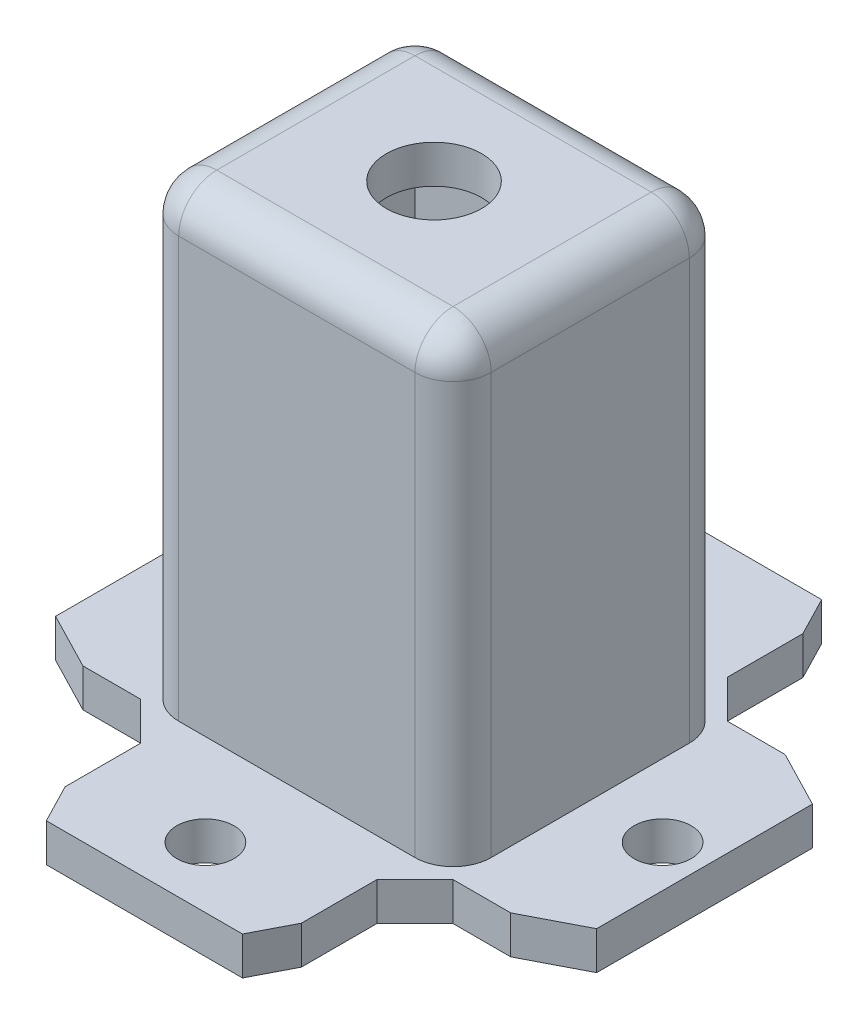
from build123d import *

# Parameters (mm, degrees)
BOSS_EXTRUDE1_START = 0.2
BOSS_EXTRUDE1_DEPTH = 12.4
SKETCH4_R           = 2.5
CUT_EXTRUDE1_DEPTH  = 12
SKETCH5_R           = 1.5
CUT_EXTRUDE2_DEPTH  = 12
BOSS_EXTRUDE3_DEPTH = 14.4
CIRPATTERN1_COUNT   = 2
CIRPATTERN1_ANGLE   = 90
CUT_EXTRUDE3_DEPTH  = 10
CHAMFER1_SIZE       = 2
FILLET1_R           = 2


with BuildPart() as part:
    # Sketch3 → Boss-Extrude1 (new body)
    with BuildSketch(Plane.ZY.offset(6.000000089).offset(BOSS_EXTRUDE1_START)):
        Polygon((5.2, 81), (5.2, 105.05), (-5.2, 105.05), (-5.2, 81), (-15.2, 81), (-15.2, 83), (-7.2, 83), (-7.2, 107.05), (7.2, 107.05), (7.2, 85.378651171), (7.2, 83), (15.2, 83), (15.2, 81), align=None)
    extrude(amount=-BOSS_EXTRUDE1_DEPTH)

    # Sketch4 → Cut-Extrude1 (cut)
    with BuildSketch(Plane(origin=(0, 107.05, 0), x_dir=(1, 0, 0), z_dir=(0, 1, 0))):
        with Locations(Location((0, 0, 0), (0, 0, 180))):
            Circle(SKETCH4_R)
    extrude(amount=-CUT_EXTRUDE1_DEPTH, mode=Mode.SUBTRACT)

    # Sketch5 → Cut-Extrude2 (cut)
    with BuildSketch(Plane(origin=(0, 83, 0), x_dir=(1, 0, 0), z_dir=(0, 1, 0))):
        with Locations(Location((-1.03e-07, 12, 0), (0, 0, 180))):
            Circle(SKETCH5_R)
        with Locations(Location((-1.03e-07, -12, 0), (0, 0, 180))):
            Circle(SKETCH5_R)
    cut_extrude2 = extrude(amount=-CUT_EXTRUDE2_DEPTH, mode=Mode.SUBTRACT)

    # Sketch7 → Boss-Extrude3 (add)
    with BuildSketch(Plane(origin=(0, 0, -7.2), x_dir=(-1, 0, 0), z_dir=(0, 0, -1))):
        Polygon((14.200000089, 83), (14.200000089, 81), (6.200000089, 81), (6.200000089, 107.05), (8.200000089, 107.05), (8.200000089, 83), align=None)
        Polygon((-8.200000089, 107.05), (-6.200000089, 107.05), (-6.200000089, 81), (-14.200000089, 81), (-14.200000089, 83), (-8.200000089, 83), align=None)
    extrude(amount=-BOSS_EXTRUDE3_DEPTH)

    # CirPattern1: Cut-Extrude2 ×2 about axis
    cirpattern1_axis = Axis((0, 0, 0), (0, 1, 0))
    for i in range(1, CIRPATTERN1_COUNT):
        add(cut_extrude2.rotate(cirpattern1_axis, i * CIRPATTERN1_ANGLE / (CIRPATTERN1_COUNT - 1)), mode=Mode.SUBTRACT)

    # Sketch11 → Cut-Extrude3 (cut)
    with BuildSketch(Plane(origin=(0, 83, 0), x_dir=(1, 0, 0), z_dir=(0, 1, 0))):
        with BuildLine():
            Line((18.453361638, 5.717898617), (11.935828042, 9.084933074))
            ThreePointArc((11.935828042, 9.084933074), (10.606601718, 10.606601718), (9.084933074, 11.935828042))
            Line((9.084933074, 11.935828042), (5.717898617, 18.453361638))
            Line((5.717898617, 18.453361638), (-5.717898617, 18.453361638))
            Line((-5.717898617, 18.453361638), (-9.084933074, 11.935828042))
            ThreePointArc((-9.084933074, 11.935828042), (-10.606601718, 10.606601718), (-11.935828042, 9.084933074))
            Line((-11.935828042, 9.084933074), (-18.453361638, 5.717898617))
            Line((-18.453361638, 5.717898617), (-18.453361638, -5.717898617))
            Line((-18.453361638, -5.717898617), (-11.935828042, -9.084933074))
            ThreePointArc((-11.935828042, -9.084933074), (-10.606601718, -10.606601718), (-9.084933074, -11.935828042))
            Line((-9.084933074, -11.935828042), (-5.717898617, -18.453361638))
            Line((-5.717898617, -18.453361638), (5.717898617, -18.453361638))
            Line((5.717898617, -18.453361638), (9.084933074, -11.935828042))
            ThreePointArc((9.084933074, -11.935828042), (10.606601718, -10.606601718), (11.935828042, -9.084933074))
            Line((11.935828042, -9.084933074), (18.453361638, -5.717898617))
            Line((18.453361638, -5.717898617), (18.453361638, 5.717898617))
        make_face()
        with BuildLine():
            Line((16.453361638, 4.5), (10.602285857, 7.522734517))
            ThreePointArc((10.602285857, 7.522734517), (9.192388155, 9.192388155), (7.522734517, 10.602285857))
            Line((7.522734517, 10.602285857), (4.5, 16.453361638))
            Line((4.5, 16.453361638), (-4.5, 16.453361638))
            Line((-4.5, 16.453361638), (-7.522734517, 10.602285857))
            ThreePointArc((-7.522734517, 10.602285857), (-9.192388155, 9.192388155), (-10.602285857, 7.522734517))
            Line((-10.602285857, 7.522734517), (-16.453361638, 4.5))
            Line((-16.453361638, 4.5), (-16.453361638, -4.5))
            Line((-16.453361638, -4.5), (-10.602285857, -7.522734517))
            ThreePointArc((-10.602285857, -7.522734517), (-9.192388155, -9.192388155), (-7.522734517, -10.602285857))
            Line((-7.522734517, -10.602285857), (-4.5, -16.453361638))
            Line((-4.5, -16.453361638), (4.5, -16.453361638))
            Line((4.5, -16.453361638), (7.522734517, -10.602285857))
            ThreePointArc((7.522734517, -10.602285857), (9.192388155, -9.192388155), (10.602285857, -7.522734517))
            Line((10.602285857, -7.522734517), (16.453361638, -4.5))
            Line((16.453361638, -4.5), (16.453361638, 4.5))
        make_face(mode=Mode.SUBTRACT)
    extrude(amount=-CUT_EXTRUDE3_DEPTH, mode=Mode.SUBTRACT)

    # Chamfer1
    chamfer1_edges = [part.edges().sort_by_distance(p)[0] for p in [
        (-6.200000089, 82, 7.2),
        (6.200000089, 82, -7.2),
        (6.200000089, 82, 7.2),
    ]]
    chamfer(chamfer1_edges, length=CHAMFER1_SIZE)

    # Fillet1
    # the kernel refuses this fillet: 2 mm, written as the material it takes off along each edge
    with BuildSketch(Plane(origin=(-6.200000089, 105.05, -5.2), x_dir=(0, 1, 0), z_dir=(0, 0, -1))) as fillet1_piece_1_section:
        Polygon((0, 0), (FILLET1_R * 1.02, 0), (FILLET1_R * 1.02, -FILLET1_R * 1.02), (0, -FILLET1_R * 1.02), align=None)
    fillet1_piece_1 = extrude(amount=FILLET1_R * 1.02, mode=Mode.PRIVATE)
    fillet1_piece_1 = fillet1_piece_1 - Plane(origin=(-6.200000089, 105.05, -5.2), x_dir=(0.7071067811865474, -0.7071067811865478, 5.985977498731896e-15), z_dir=(0, 0, -1)) * Sphere(FILLET1_R, mode=Mode.PRIVATE)
    add(fillet1_piece_1, mode=Mode.SUBTRACT)
    with BuildSketch(Plane(origin=(6.200000089, 105.05, -5.2), x_dir=(0, 0, -1), z_dir=(1, 0, 0))) as fillet1_piece_2_section:
        Polygon((0, 0), (FILLET1_R * 1.02, 0), (FILLET1_R * 1.02, FILLET1_R * 1.02), (0, FILLET1_R * 1.02), align=None)
    fillet1_piece_2 = extrude(amount=FILLET1_R * 1.02, mode=Mode.PRIVATE)
    fillet1_piece_2 = fillet1_piece_2 - Plane(origin=(6.200000089, 105.05, -5.2), x_dir=(-6.4472925120618815e-15, -0.7071067811865475, 0.7071067811865475), z_dir=(1, 0, 0)) * Sphere(FILLET1_R, mode=Mode.PRIVATE)
    add(fillet1_piece_2, mode=Mode.SUBTRACT)
    with BuildSketch(Plane(origin=(6.200000089, 105.05, 5.2), x_dir=(0, 0, 1), z_dir=(1, 0, 0))) as fillet1_piece_3_section:
        Polygon((0, 0), (FILLET1_R * 1.02, 0), (FILLET1_R * 1.02, -FILLET1_R * 1.02), (0, -FILLET1_R * 1.02), align=None)
    fillet1_piece_3 = extrude(amount=FILLET1_R * 1.02, mode=Mode.PRIVATE)
    fillet1_piece_3 = fillet1_piece_3 - Plane(origin=(6.200000089, 105.05, 5.2), x_dir=(5.5246624854019046e-15, -0.7071067811865475, -0.7071067811865475), z_dir=(1, 0, 0)) * Sphere(FILLET1_R, mode=Mode.PRIVATE)
    add(fillet1_piece_3, mode=Mode.SUBTRACT)
    with BuildSketch(Plane(origin=(-6.200000089, 105.05, 5.2), x_dir=(0, 1, 0), z_dir=(0, 0, 1))) as fillet1_piece_4_section:
        Polygon((0, 0), (FILLET1_R * 1.02, 0), (FILLET1_R * 1.02, FILLET1_R * 1.02), (0, FILLET1_R * 1.02), align=None)
    fillet1_piece_4 = extrude(amount=FILLET1_R * 1.02, mode=Mode.PRIVATE)
    fillet1_piece_4 = fillet1_piece_4 - Plane(origin=(-6.200000089, 105.05, 5.2), x_dir=(0.7071067811865474, -0.7071067811865478, 5.985977498731896e-15), z_dir=(0, 0, 1)) * Sphere(FILLET1_R, mode=Mode.PRIVATE)
    add(fillet1_piece_4, mode=Mode.SUBTRACT)
    with BuildSketch(Plane(origin=(-6.200000089, 107.05, -7.2), x_dir=(0, 0, 1), z_dir=(1, 0, 0)), Plane(origin=(6.200000089, 107.05, 7.2), x_dir=(0, 0, -1), z_dir=(-1, 0, 0))) as fillet1_piece_5:
        with BuildLine():
            CenterArc((FILLET1_R, FILLET1_R), FILLET1_R, 180, 90)
            Line((0, FILLET1_R), (0, 0))
            Line((0, 0), (FILLET1_R, 0))
        make_face()
    extrude(amount=12.400000179, mode=Mode.SUBTRACT)
    with BuildSketch(Plane(origin=(-8.200000089, 105.05, -7.2), x_dir=(0, 0, 1), z_dir=(0, -1, 0)), Plane(origin=(8.200000089, 83, -7.2), x_dir=(0, 0, 1), z_dir=(0, 1, 0))) as fillet1_piece_6:
        with BuildLine():
            CenterArc((FILLET1_R, -FILLET1_R), FILLET1_R, 90, 90)
            Line((0, -FILLET1_R), (0, 0))
            Line((0, 0), (FILLET1_R, 0))
        make_face()
    extrude(amount=22.05, mode=Mode.SUBTRACT)
    with BuildSketch(Plane(origin=(-8.200000089, 105.05, 7.2), x_dir=(0, 0, -1), z_dir=(0, -1, 0)), Plane(origin=(8.200000089, 83, 7.2), x_dir=(0, 0, -1), z_dir=(0, 1, 0))) as fillet1_piece_7:
        with BuildLine():
            CenterArc((FILLET1_R, FILLET1_R), FILLET1_R, 180, 90)
            Line((0, FILLET1_R), (0, 0))
            Line((0, 0), (FILLET1_R, 0))
        make_face()
    extrude(amount=22.05, mode=Mode.SUBTRACT)
    with BuildSketch(Plane(origin=(-8.200000089, 107.05, -5.2), x_dir=(1, 0, 0), z_dir=(0, 0, 1))) as fillet1_piece_8:
        with BuildLine():
            CenterArc((FILLET1_R, -FILLET1_R), FILLET1_R, 90, 90)
            Line((0, -FILLET1_R), (0, 0))
            Line((0, 0), (FILLET1_R, 0))
        make_face()
    extrude(amount=10.4, mode=Mode.SUBTRACT)
    with BuildSketch(Plane(origin=(8.200000089, 107.05, -5.2), x_dir=(-1, 0, 0), z_dir=(0, 0, 1))) as fillet1_piece_9:
        with BuildLine():
            CenterArc((FILLET1_R, FILLET1_R), FILLET1_R, 180, 90)
            Line((0, FILLET1_R), (0, 0))
            Line((0, 0), (FILLET1_R, 0))
        make_face()
    extrude(amount=10.4, mode=Mode.SUBTRACT)


solid = part.part
